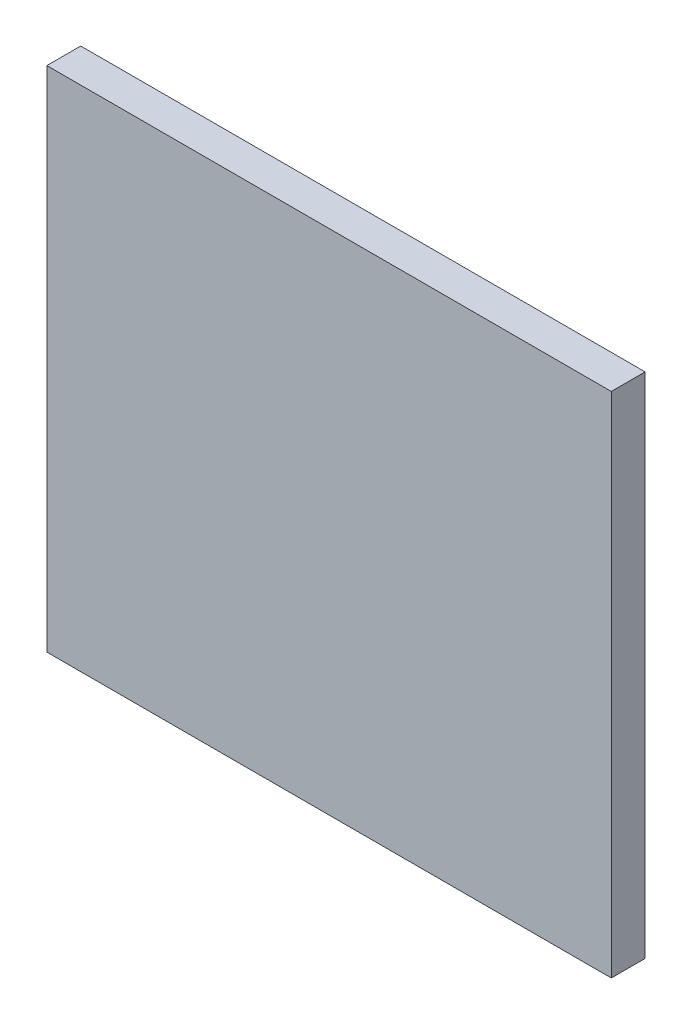
from build123d import *

# Parameters (mm, degrees)
SKETCH1_W           = 50
SKETCH1_H           = 45
BOSS_EXTRUDE1_DEPTH = 3


with BuildPart() as part:
    # Sketch1 → Boss-Extrude1 (new body)
    with BuildSketch(Plane.XY):
        with Locations((-25, 22.5)):
            Rectangle(SKETCH1_W, SKETCH1_H)
    extrude(amount=BOSS_EXTRUDE1_DEPTH)


solid = part.part
